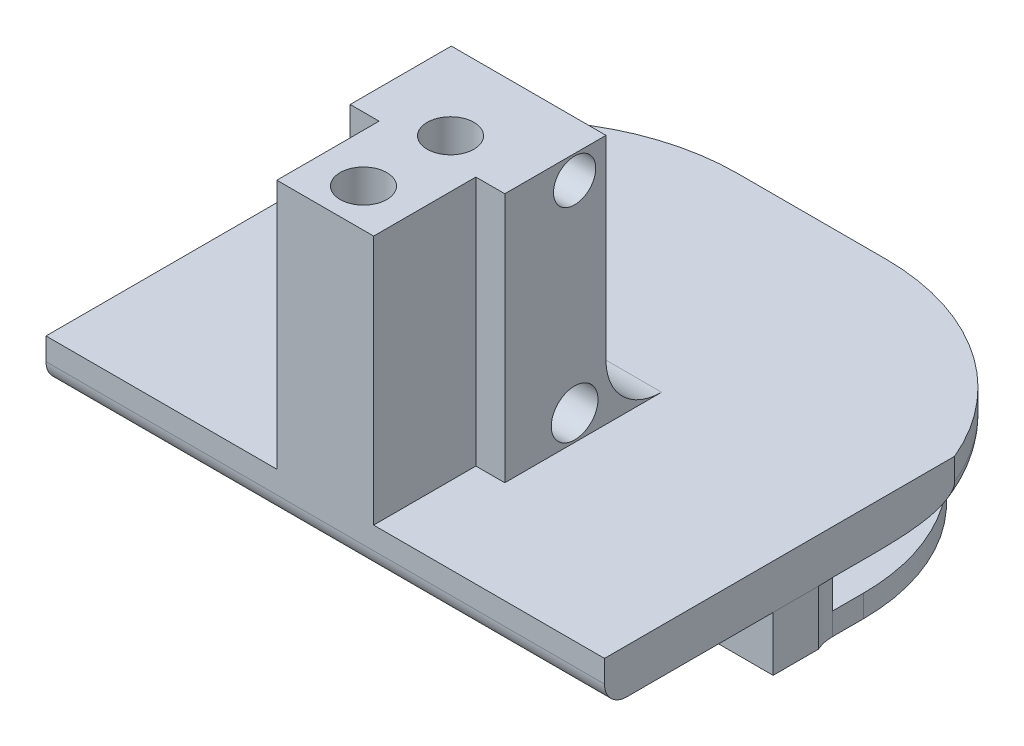
from build123d import *

# Parameters (mm, degrees)
SALIENTE_EXTRUIR1_DEPTH     = 2
SALIENTE_EXTRUIR2_DEPTH     = 24.5
SALIENTE_EXTRUIR3_DEPTH     = 22.5
CORTAR_EXTRUIR1_DEPTH       = 27
CORTAR_EXTRUIR1_DEPTH_BACK  = 65.5
CROQUIS4_R                  = 1.599999999
REDONDEO1_R                 = 3
REDONDEO2_R                 = 5
SALIENTE_EXTRUIR5_START     = 2
SALIENTE_EXTRUIR5_DEPTH     = 2
CROQUIS16_W                 = 2.6
CROQUIS16_H                 = 16.420237112
CORTAR_EXTRUIR8_DEPTH       = 22.5
REDONDEO6_R                 = 2
REDONDEO7_R                 = 2
CROQUIS5_R                  = 2.1
CORTAR_EXTRUIR2_DEPTH       = 20.5
CROQUIS17_R                 = 2.1
CORTAR_EXTRUIR9_DEPTH       = 10
CORTAR_EXTRUIR14_DEPTH      = 11
CORTAR_EXTRUIR14_DEPTH_BACK = 10
CROQUIS18_R                 = 1.9
CROQUIS19_R                 = 18.5
CORTAR_EXTRUIR15_DEPTH      = 3.5
CORTAR_EXTRUIR16_START      = -56
CROQUIS20_R                 = 18.5
CORTAR_EXTRUIR16_DEPTH      = 3.5
CROQUIS21_W                 = 93.525691526
CROQUIS21_H                 = 152.705287602
CROQUIS21_W_2               = 50.201984064
CROQUIS21_H_2               = 74.038187446
CORTAR_EXTRUIR17_DEPTH      = 79
SALIENTE_EXTRUIR6_DEPTH     = 5
CROQUIS23_W                 = 15
CROQUIS23_H                 = 3
CORTAR_EXTRUIR18_DEPTH      = 87


# Read off the part's stored shape, not the designer's step: Saliente-Extruir6
with BuildPart() as part:
    # Croquis1 → Saliente-Extruir1 (new body)
    with BuildSketch(Plane(origin=(0, 0, 0), x_dir=(1, 0, 0), z_dir=(0, 1, 0))):
        with BuildLine():
            Line((-31.5, -9.464532567), (31.5, -9.464532567))
            Line((31.5, -9.464532567), (31.5, 7.964532567))
            ThreePointArc((31.5, 7.964532567), (31.060660172, 9.025192739), (30, 9.464532567))
            Line((30, 9.464532567), (28.160101256, 9.464532567))
            ThreePointArc((28.160101256, 9.464532567), (27.099441084, 9.903872396), (26.660101256, 10.964532567))
            Line((26.660101256, 10.964532567), (26.660101256, 14.266885585))
            ThreePointArc((26.660101256, 14.266885585), (20.802236879, 28.409021208), (6.660101256, 34.266885585))
            Line((6.660101256, 34.266885585), (-6.660101256, 34.266885585))
            ThreePointArc((-6.660101256, 34.266885585), (-20.802236879, 28.409021208), (-26.660101256, 14.266885585))
            Line((-26.660101256, 14.266885585), (-26.660101256, 10.964532567))
            ThreePointArc((-26.660101256, 10.964532567), (-27.099441084, 9.903872396), (-28.160101256, 9.464532567))
            Line((-28.160101256, 9.464532567), (-30, 9.464532567))
            ThreePointArc((-30, 9.464532567), (-31.060660172, 9.025192739), (-31.5, 7.964532567))
            Line((-31.5, 7.964532567), (-31.5, -9.464532567))
        make_face()
    extrude(amount=SALIENTE_EXTRUIR1_DEPTH)

    # Croquis2 → Saliente-Extruir2 (add)
    with BuildSketch(Plane(origin=(0, 0, 0), x_dir=(1, 0, 0), z_dir=(0, 1, 0))):
        Polygon((6.95, -8.819174125), (6.95, -9.464532567), (-6.95, -9.464532567), (-6.95, -8.819174125), (-6.95, 8.819174125), (6.95, 8.819174125), align=None)
    extrude(amount=SALIENTE_EXTRUIR2_DEPTH)

    # Croquis3 → Saliente-Extruir3 (add)
    with BuildSketch(Plane(origin=(0, 2, 0), x_dir=(1, 0, 0), z_dir=(0, 1, 0))):
        with BuildLine():
            ThreePointArc((28.160101256, 9.464532567), (27.375457574, 9.686121721), (26.822638598, 10.285420177))
            Line((26.822638598, 10.285420177), (25.6, 10.285420177))
            Line((25.6, 10.285420177), (25.6, -2.749999823))
            Line((25.6, -2.749999823), (31.5, -2.749999823))
            Line((31.5, -2.749999823), (31.5, 7.964532567))
            ThreePointArc((31.5, 7.964532567), (31.060660172, 9.025192739), (30, 9.464532567))
            Line((30, 9.464532567), (28.160101256, 9.464532567))
        make_face()
        with BuildLine():
            Line((-25.6, 10.285420177), (-26.822638598, 10.285420177))
            ThreePointArc((-26.822638598, 10.285420177), (-27.375457574, 9.686121721), (-28.160101256, 9.464532567))
            Line((-28.160101256, 9.464532567), (-30, 9.464532567))
            ThreePointArc((-30, 9.464532567), (-31.060660172, 9.025192739), (-31.5, 7.964532567))
            Line((-31.5, 7.964532567), (-31.5, -2.749999823))
            Line((-31.5, -2.749999823), (-25.6, -2.749999823))
            Line((-25.6, -2.749999823), (-25.6, 10.285420177))
        make_face()
    extrude(amount=SALIENTE_EXTRUIR3_DEPTH)

    # Croquis4 → Cortar-Extruir1 (cut, two sides: drawn at the far end of the back side and taken through both)
    with BuildSketch(Plane.ZY.offset(25.5).offset(-CORTAR_EXTRUIR1_DEPTH_BACK)):
        with Locations((-6.002353017, 4.3)):
            Circle(CROQUIS4_R)
        with Locations((-6.002353017, 22.4)):
            Circle(CROQUIS4_R)
    extrude(amount=CORTAR_EXTRUIR1_DEPTH + CORTAR_EXTRUIR1_DEPTH_BACK, mode=Mode.SUBTRACT)

    # Redondeo1
    redondeo1_edges = [part.edges().sort_by_distance(p)[0] for p in [
        (28.55, 2, 2.749999823),
    ]]
    fillet(redondeo1_edges, radius=REDONDEO1_R)

    # Redondeo2
    redondeo2_edges = [part.edges().sort_by_distance(p)[0] for p in [
        (0, 2, -8.819174125),
    ]]
    fillet(redondeo2_edges, radius=REDONDEO2_R)

    # Croquis15 → Saliente-Extruir5 (add)
    with BuildSketch(Plane.XZ.offset(SALIENTE_EXTRUIR5_START)):
        with BuildLine():
            Line((-31.5, 9.464532567), (31.5, 9.464532567))
            Line((31.5, 9.464532567), (31.5, -7.489095092))
            ThreePointArc((31.5, -7.489095092), (30.914213562, -8.903308654), (29.5, -9.489095092))
            Line((29.5, -9.489095092), (28.660101256, -9.489095092))
            ThreePointArc((28.660101256, -9.489095092), (27.245887693, -10.074881529), (26.660101256, -11.489095092))
            Line((26.660101256, -11.489095092), (26.660101256, -14.266885585))
            ThreePointArc((26.660101256, -14.266885585), (20.802236879, -28.409021208), (6.660101256, -34.266885585))
            Line((6.660101256, -34.266885585), (1.137553535, -34.266885585))
            Line((1.137553535, -34.266885585), (-1.137553535, -34.266885585))
            Line((-1.137553535, -34.266885585), (-6.660101256, -34.266885585))
            ThreePointArc((-6.660101256, -34.266885585), (-20.802236879, -28.409021208), (-26.660101256, -14.266885585))
            Line((-26.660101256, -14.266885585), (-26.660101256, -11.489095092))
            ThreePointArc((-26.660101256, -11.489095092), (-27.245887693, -10.074881529), (-28.660101256, -9.489095092))
            Line((-28.660101256, -9.489095092), (-29.5, -9.489095092))
            ThreePointArc((-29.5, -9.489095092), (-30.914213562, -8.903308654), (-31.5, -7.489095092))
            Line((-31.5, -7.489095092), (-31.5, 9.464532567))
        make_face()
    extrude(amount=-SALIENTE_EXTRUIR5_DEPTH)

    # Croquis16 → Cortar-Extruir8 (cut)
    with BuildSketch(Plane(origin=(0, 24.5, 0), x_dir=(1, 0, 0), z_dir=(0, 1, 0))):
        with Locations((5.65, -8.484535845)):
            Rectangle(CROQUIS16_W, CROQUIS16_H)
        with Locations((-5.65, -8.484535845)):
            Rectangle(CROQUIS16_W, CROQUIS16_H)
    extrude(amount=-CORTAR_EXTRUIR8_DEPTH, mode=Mode.SUBTRACT)

    # Redondeo6
    redondeo6_edges = [part.edges().sort_by_distance(p)[0] for p in [
        (-31.5, -2, 0.987718738),
        (-30.914213562, -2, -8.903308654),
        (-29.080050628, -2, -9.489095092),
        (-27.245887693, -2, -10.074881529),
        (-26.660101256, -2, -12.877990338),
        (-20.802236879, -2, -28.409021208),
        (0, -2, -34.266885585),
        (20.802236879, -2, -28.409021208),
        (26.660101256, -2, -12.877990338),
        (27.245887693, -2, -10.074881529),
        (29.080050628, -2, -9.489095092),
        (30.914213562, -2, -8.903308654),
        (31.5, -2, 0.987718738),
    ]]
    fillet(redondeo6_edges, radius=REDONDEO6_R - 0.0001)  # a hair under: the kernel refuses the full size

    # Redondeo7
    redondeo7_edges = [part.edges().sort_by_distance(p)[0] for p in [
        (0, -2, 9.464532567),
        (30.914242852, -1.414242852, 9.464532567),
        (-30.914242852, -1.414242852, 9.464532567),
        (31.5, 0.99995, 9.464532567),
        (-31.5, 0.99995, 9.464532567),
    ]]
    fillet(redondeo7_edges, radius=REDONDEO7_R - 0.0001)  # a hair under: the kernel refuses the full size

    # Croquis5 → Cortar-Extruir2 (cut)
    with BuildSketch(Plane(origin=(0, 24.5, 0), x_dir=(1, 0, 0), z_dir=(0, 1, 0))):
        with Locations(Location((0, 1.798301608, 0), (0, 0, 270))):
            Circle(CROQUIS5_R)
        with Locations(Location((0, -6.026932469, 0), (0, 0, 270))):
            Circle(CROQUIS5_R)
        with Locations(Location((-28.55, 1.798301608, 0), (0, 0, 270))):
            Circle(CROQUIS5_R)
        with Locations(Location((28.55, 1.798301608, 0), (0, 0, 270))):
            Circle(CROQUIS5_R)
    extrude(amount=-CORTAR_EXTRUIR2_DEPTH, mode=Mode.SUBTRACT)

    # Croquis17 → Cortar-Extruir9 (cut, symmetric)
    with BuildSketch(Plane(origin=(0, 0, 0), x_dir=(0, 0, -1), z_dir=(1, 0, 0))):
        with Locations((6.002353017, 4.3)):
            Circle(CROQUIS17_R)
    extrude(amount=CORTAR_EXTRUIR9_DEPTH, both=True, mode=Mode.SUBTRACT)

    # Croquis18 → Cortar-Extruir14 (cut, two sides: drawn at the far end of the back side and taken through both)
    with BuildSketch(Plane(origin=(0, 0, 0), x_dir=(0, 0, -1), z_dir=(1, 0, 0)).offset(-CORTAR_EXTRUIR14_DEPTH_BACK)):
        with Locations(Location((6.002353017, 22.4, 0), (0, 0, 180))):
            Circle(CROQUIS18_R)
    extrude(amount=CORTAR_EXTRUIR14_DEPTH + CORTAR_EXTRUIR14_DEPTH_BACK, mode=Mode.SUBTRACT)

    # Croquis19 → Cortar-Extruir15 (cut)
    with BuildSketch(Plane(origin=(31.5, 0, 0), x_dir=(0, 0, -1), z_dir=(1, 0, 0))):
        with Locations((25.179802512, 14.045485316)):
            Circle(CROQUIS19_R)
    extrude(amount=-CORTAR_EXTRUIR15_DEPTH, mode=Mode.SUBTRACT)

    # Croquis20 → Cortar-Extruir16 (cut)
    with BuildSketch(Plane(origin=(28, 0, 0), x_dir=(0, 0, -1), z_dir=(1, 0, 0)).offset(CORTAR_EXTRUIR16_START)):
        with Locations((25.179802512, 14.045485316)):
            Circle(CROQUIS20_R)
    extrude(amount=-CORTAR_EXTRUIR16_DEPTH, mode=Mode.SUBTRACT)

    # Croquis21 → Cortar-Extruir17 (cut)
    with BuildSketch(Plane(origin=(0, 24.5, 0), x_dir=(1, 0, 0), z_dir=(0, 1, 0))):
        Rectangle(CROQUIS21_W, CROQUIS21_H)
        Rectangle(CROQUIS21_W_2, CROQUIS21_H_2, mode=Mode.SUBTRACT)
    extrude(amount=-CORTAR_EXTRUIR17_DEPTH, mode=Mode.SUBTRACT)

    # Saliente-Extruir6 outline → Saliente-Extruir6 (add)
    with BuildSketch(Plane.XZ.offset(2)):
        with BuildLine():
            Line((25.004354391, -5.79015449), (-25.100992032, -5.79015449))
            Line((-25.100992032, -5.79015449), (-25.100992032, -14.266885585))
            Line((-25.100992032, -14.266885585), (-24.660101256, -14.266885585))
            ThreePointArc((-24.660101256, -14.266885585), (-19.388023317, -26.994807646), (-6.660101256, -32.266885585))
            Line((-6.660101256, -32.266885585), (6.660101256, -32.266885585))
            ThreePointArc((6.660101256, -32.266885585), (19.388023317, -26.994807646), (24.660101256, -14.266885585))
            Line((24.660101256, -14.266885585), (24.660101256, -11.489095092))
            ThreePointArc((24.660101256, -11.489095092), (24.747110874, -10.659332312), (25.004354391, -9.865668204))
            Line((25.004354391, -9.865668204), (25.004354391, -5.79015449))
        make_face()
    extrude(amount=SALIENTE_EXTRUIR6_DEPTH)

    # Croquis23 → Cortar-Extruir18 (cut)
    with BuildSketch(Plane(origin=(24.660101256, 0, 0), x_dir=(0, 0, -1), z_dir=(1, 0, 0))):
        with Locations((18.051411886, -3.5)):
            Rectangle(CROQUIS23_W, CROQUIS23_H)
    extrude(amount=-CORTAR_EXTRUIR18_DEPTH, mode=Mode.SUBTRACT)


solid = part.part
